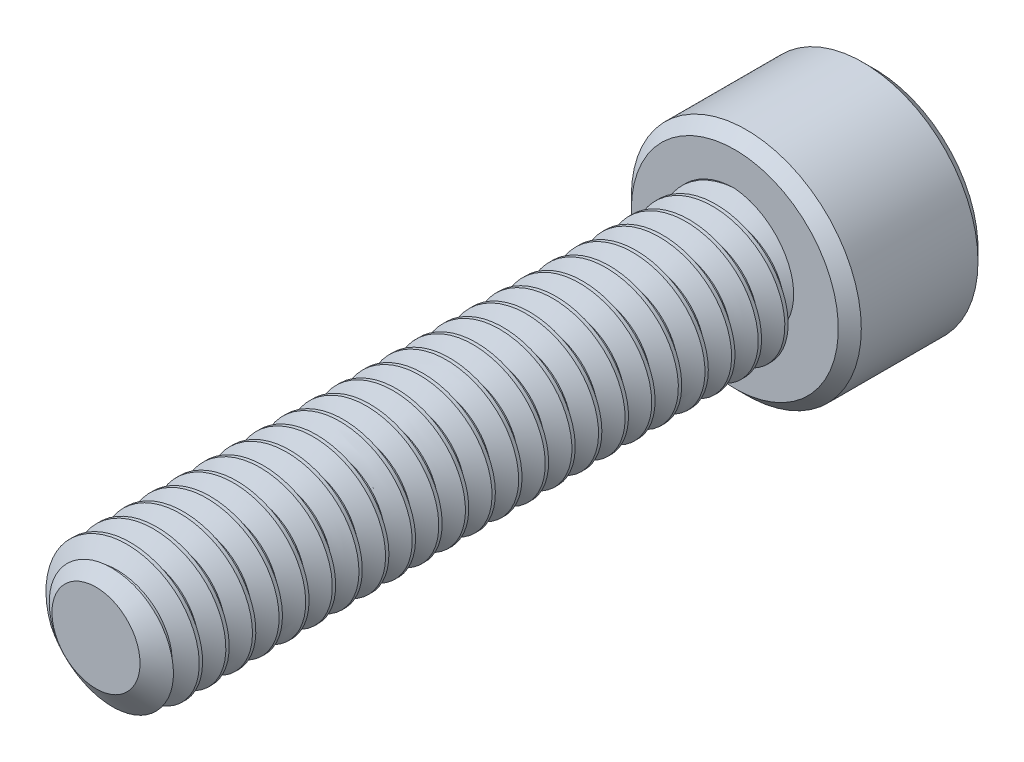
from build123d import *

# Parameters (mm, degrees)
SKETCH1_R          = 2.0828
EXTRUDE1_DEPTH     = 19.05
CUT_SWEEP1_PITCH   = 0.79375
SKETCH6_R          = 3.429
EXTRUDE2_DEPTH     = 4.1656
CUT_EXTRUDE1_DEPTH = 2.67890625
CHAMFER1_SIZE      = 0.3429


with BuildPart() as part:
    # Sketch1 → Extrude1 (new body)
    with BuildSketch(Plane.XY):
        Circle(SKETCH1_R)
    extrude(amount=-EXTRUDE1_DEPTH)

    # Cut-Sweep1: the profile of Sketch3 profile screwed along a right-hand helix of 25 turns, 6 arcs to a turn; built about Z, then put on its axis
    cut_sweep1_z = Axis((0, 0, 0), (0, 0, 1))
    cut_sweep1_corners = [(2.0831, 0, -0.694704455), (1.567244252, 0, -0.396875), (1.567244252, 0, -0.29765625), (2.0831, 0, 0.000173205)]
    with BuildLine(mode=Mode.PRIVATE) as cut_sweep1_profile:
        Line(cut_sweep1_corners[0], cut_sweep1_corners[1])
        Line(cut_sweep1_corners[1], cut_sweep1_corners[2])
        Line(cut_sweep1_corners[2], cut_sweep1_corners[3])
        Line(cut_sweep1_corners[3], cut_sweep1_corners[0])
    cut_sweep1_cap = Face(cut_sweep1_profile.wire())
    cut_sweep1_turn_angles = [0, 30, 60, 90, 120, 150, 180, 210, 240, 270, 300, 330, 360]
    cut_sweep1_turn_weights = [1, 0.8660254037844387, 1, 0.8660254037844387, 1, 0.8660254037844387, 1, 0.8660254037844387, 1, 0.8660254037844387, 1, 0.8660254037844387, 1]
    cut_sweep1_turn_rails = [Edge.make_bspline([Vector(p[0], p[1], 0).rotate(cut_sweep1_z, cut_sweep1_turn_angles[k]) / cut_sweep1_turn_weights[k] + Vector(0, 0, p[2] + CUT_SWEEP1_PITCH * cut_sweep1_turn_angles[k] / 360) for k in range(13)], [0, 0, 0, 1, 1, 2, 2, 3, 3, 4, 4, 5, 5, 6, 6, 6], 2, cut_sweep1_turn_weights) for p in cut_sweep1_corners]
    cut_sweep1_turn_sides = [Face.make_surface_from_curves(cut_sweep1_turn_rails[p[0]], cut_sweep1_turn_rails[p[1]]) for p in [(0, 1), (1, 2), (2, 3), (3, 0)]]
    cut_sweep1 = Plane(origin=(0, 0, 0), x_dir=(0, 1, 0), z_dir=(0, 0, -1)) * Solid(Shell([*[p.moved(Location((0, 0, CUT_SWEEP1_PITCH * i))) for i in range(25) for p in cut_sweep1_turn_sides], cut_sweep1_cap, cut_sweep1_cap.rotate(cut_sweep1_z, 9000).moved(Location((0, 0, CUT_SWEEP1_PITCH * 9000 / 360)))]))
    add(cut_sweep1, mode=Mode.SUBTRACT)

    # Sketch4 → Cut-Revolve1 (revolve, cut)
    with BuildSketch(Plane(origin=(0, 0, 0), x_dir=(0, 0, -1), z_dir=(1, 0, 0)), mode=Mode.PRIVATE) as cut_revolve1_sk:
        Polygon((0.538848736, 2.0828), (0, 1.313244252), (0, 2.0828), align=None)
    revolve(cut_revolve1_sk.sketch.rotate(Axis((0, 0, 0), (0, 0, -1)), 261.048315518), axis=Axis((0, 0, 0), (0, 0, -1)), mode=Mode.SUBTRACT)

    # Sketch6 → Extrude2 (add)
    with BuildSketch(Plane(origin=(0, 0, -19.05), x_dir=(-1, 0, 0), z_dir=(0, 0, -1))):
        Circle(SKETCH6_R)
    extrude(amount=EXTRUDE2_DEPTH)

    # Sketch7 → Cut-Extrude1 (cut)
    with BuildSketch(Plane(origin=(0, 0, -23.2156), x_dir=(-1, 0, 0), z_dir=(0, 0, -1))):
        Polygon((0, 2.062222993), (-1.7859375, 1.031111496), (-1.7859375, -1.031111496), (0, -2.062222993), (1.7859375, -1.031111496), (1.7859375, 1.031111496), align=None)
    extrude(amount=-CUT_EXTRUDE1_DEPTH, mode=Mode.SUBTRACT)

    # Cut-Extrude2 cone 1 section (through the dimple's axis) → Cut-Extrude2 (revolve, cut)
    with BuildSketch(Plane(origin=(0, 0, -23.2156), x_dir=(0, 1, 0), z_dir=(1, 0, 0))):
        Polygon((0, 0), (2.062222993, 0), (0, 2.062222993), align=None)
    revolve(axis=Axis((0, 0, -23.2156), (0, 0, 1)), mode=Mode.SUBTRACT)

    # Chamfer1
    chamfer1_edges = [part.edges().sort_by_distance(p)[0] for p in [
        (3.429, 0, -19.05),
        (3.429, 0, -23.2156),
    ]]
    chamfer(chamfer1_edges, length=CHAMFER1_SIZE)


solid = part.part
